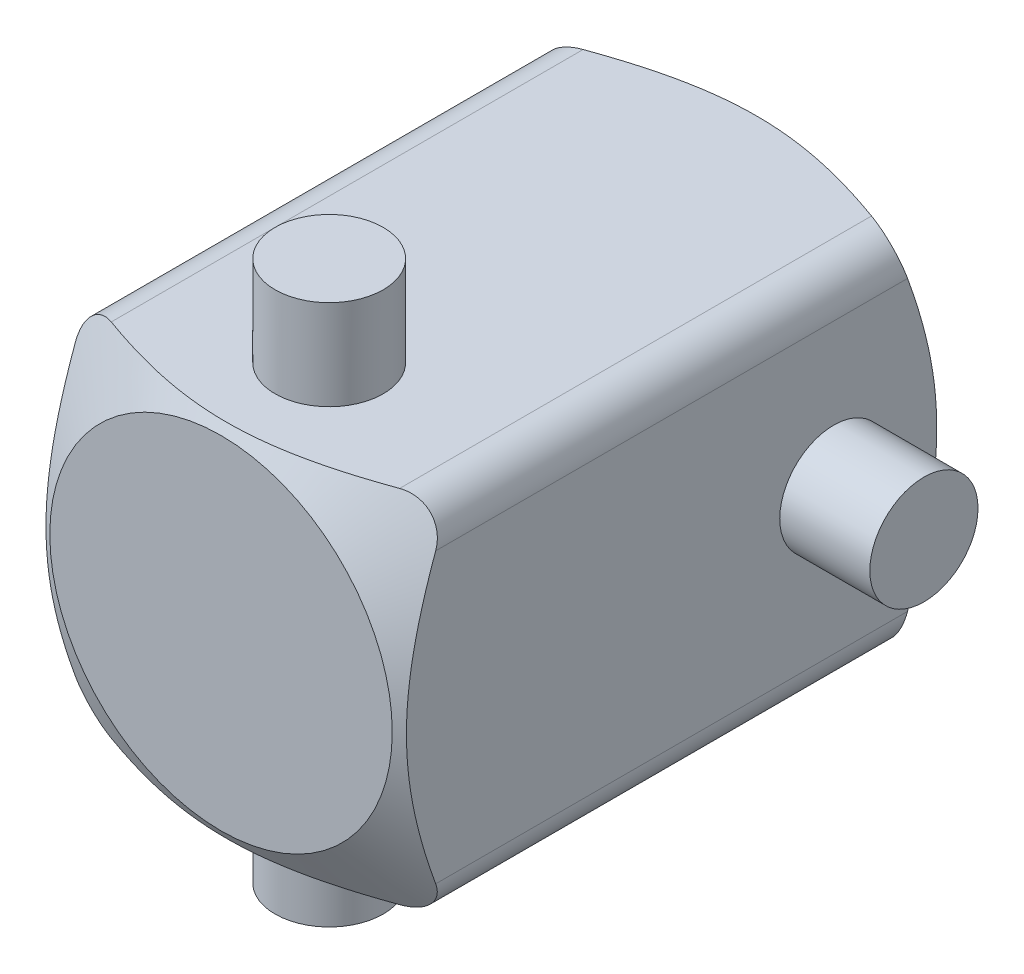
from build123d import *

# Parameters (mm, degrees)
CROQUIS1_W              = 10
CROQUIS1_H              = 10
SALIENTE_EXTRUIR1_DEPTH = 15
REDONDEO1_R             = 1
CROQUIS4_R              = 1.5
SALIENTE_EXTRUIR2_DEPTH = 7.5
CROQUIS5_R              = 1.5
SALIENTE_EXTRUIR3_DEPTH = 7.5


with BuildPart() as part:
    # Croquis1 → Saliente-Extruir1 (new body)
    with BuildSketch(Plane.XY):
        Rectangle(CROQUIS1_W, CROQUIS1_H)
    extrude(amount=SALIENTE_EXTRUIR1_DEPTH)

    # Croquis3 → Cortar-Revolución1 (revolve, cut)
    with BuildSketch(Plane(origin=(0, 0, 0), x_dir=(0, 0, -1), z_dir=(1, 0, 0))):
        Polygon((-15, 4.75), (-15, 15.04), (0, 15.04), (0, 4.75), (-4.474464586, 12.5), (-10.525535414, 12.5), align=None)
    revolve(axis=Axis((0, 0, -0.75), (0, 0, 1)), mode=Mode.SUBTRACT)

    # Redondeo1
    redondeo1_edges = [part.edges().sort_by_distance(p)[0] for p in [
        (-5, 5, 7.5),
        (-5, -5, 7.5),
        (5, -5, 7.5),
        (5, 5, 7.5),
    ]]
    fillet(redondeo1_edges, radius=REDONDEO1_R)

    # Croquis4 → Saliente-Extruir2 (add, symmetric)
    with BuildSketch(Plane(origin=(0, 0, 0), x_dir=(0, 0, -1), z_dir=(1, 0, 0))):
        with Locations((-3, 0)):
            Circle(CROQUIS4_R)
    extrude(amount=SALIENTE_EXTRUIR2_DEPTH, both=True)

    # Croquis5 → Saliente-Extruir3 (add, symmetric)
    with BuildSketch(Plane(origin=(0, 0, 0), x_dir=(1, 0, 0), z_dir=(0, 1, 0))):
        with Locations((0, -12)):
            Circle(CROQUIS5_R)
    extrude(amount=SALIENTE_EXTRUIR3_DEPTH, both=True)


solid = part.part
